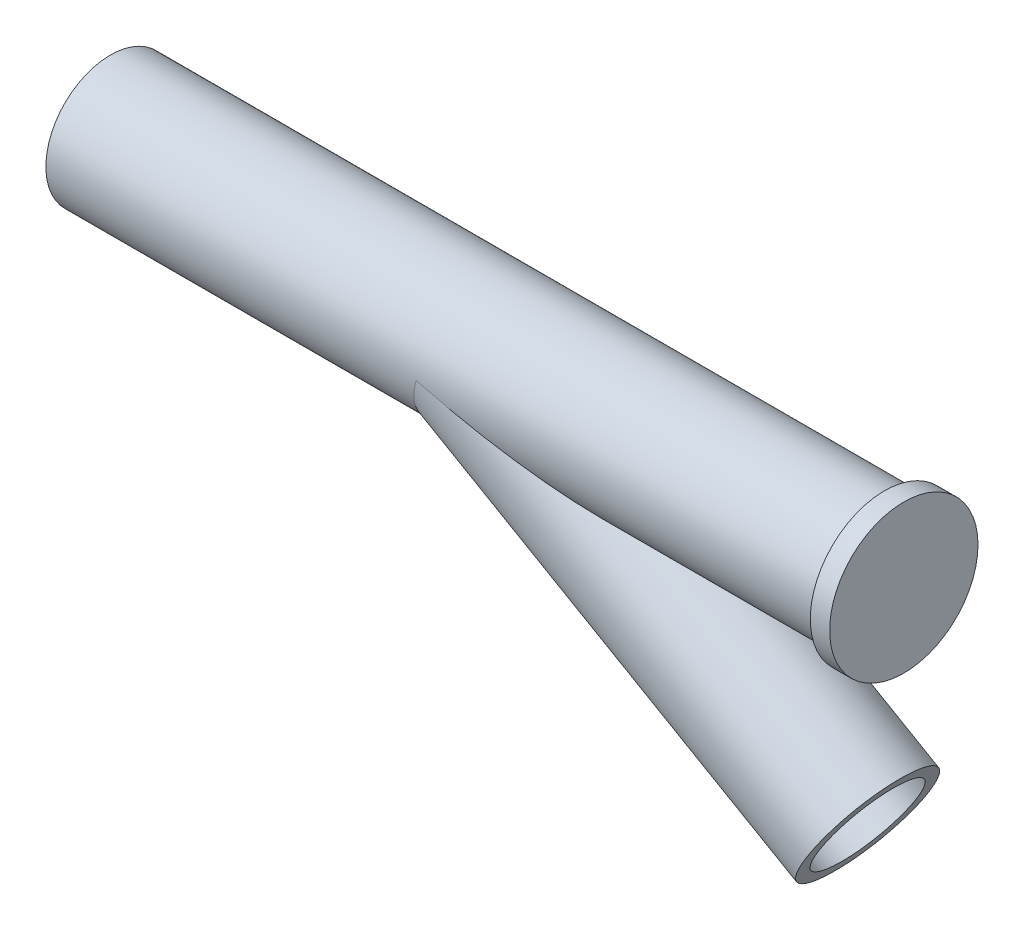
from build123d import *

# Parameters (mm, degrees)
SWEEP1_PROFILE_R    = 10
SWEEP2_PROFILE_R    = 10
SHELL2_START        = -57.391158908
SHELL2_OUTLINE_R    = 8
SHELL2_DEPTH        = 120
SHELL2_START_2      = -1e-07
SHELL2_2_OUTLINE_R  = 8
SHELL2_2_DEPTH      = 69.282032403
SKETCH27_R          = 11.5
BOSS_EXTRUDE2_DEPTH = 3
SCALE1_SCALE        = 0.1


with BuildPart() as part:
    # Sweep1: sweep along a path in Sketch3
    with BuildLine(Plane.XY) as sweep1_path:
        Line((-57.391158908, 0), (62.608841092, 0))
    # Sweep1 profile (on start of the path) → Sweep1 (sweep)
    with BuildSketch(Plane(origin=(-57.391158908, 0, 0), x_dir=(0, 0, 1), z_dir=(1, 0, 0))):
        Circle(SWEEP1_PROFILE_R)
    sweep(path=sweep1_path.line)

    # Sweep2: sweep along a path in Sketch3<4>
    with BuildLine(Plane.XY) as sweep2_path:
        Line((0, 0), (60, -34.641016151))
    # Sweep2 profile (on start of the path) → Sweep2 (sweep)
    with BuildSketch(Plane(origin=(0, 0, 0), x_dir=(0.500000000000001, 0.8660254037844382, 0), z_dir=(0.8660254037844382, -0.500000000000001, 0))):
        Circle(SWEEP2_PROFILE_R)
    sweep(path=sweep2_path.line)

    # Shell2: read off the stored shape, not the designer's step
    # Shell2 outline → Shell2 (cut)
    with BuildSketch(Plane.YZ.offset(SHELL2_START)):
        Circle(SHELL2_OUTLINE_R)
    extrude(amount=SHELL2_DEPTH, mode=Mode.SUBTRACT)

    # Shell2 2 outline → Shell2 2 (cut)
    with BuildSketch(Plane(origin=(0, 0, 0), x_dir=(0.500000000000001, 0.866025403784438, 0), z_dir=(0.866025403784438, -0.500000000000001, 0)).offset(SHELL2_START_2)):
        Circle(SHELL2_2_OUTLINE_R)
    extrude(amount=SHELL2_2_DEPTH, mode=Mode.SUBTRACT)

    # Sketch27 → Boss-Extrude2 (add)
    with BuildSketch(Plane(origin=(62.608841092, 0, 0), x_dir=(0, 0, -1), z_dir=(1, 0, 0))):
        Circle(SKETCH27_R)
    extrude(amount=BOSS_EXTRUDE2_DEPTH)


with BuildPart() as part_1:
    # Scale1: scaled about (0, 0, 0)
    add(part.part.scale(SCALE1_SCALE))


solid = part_1.part
